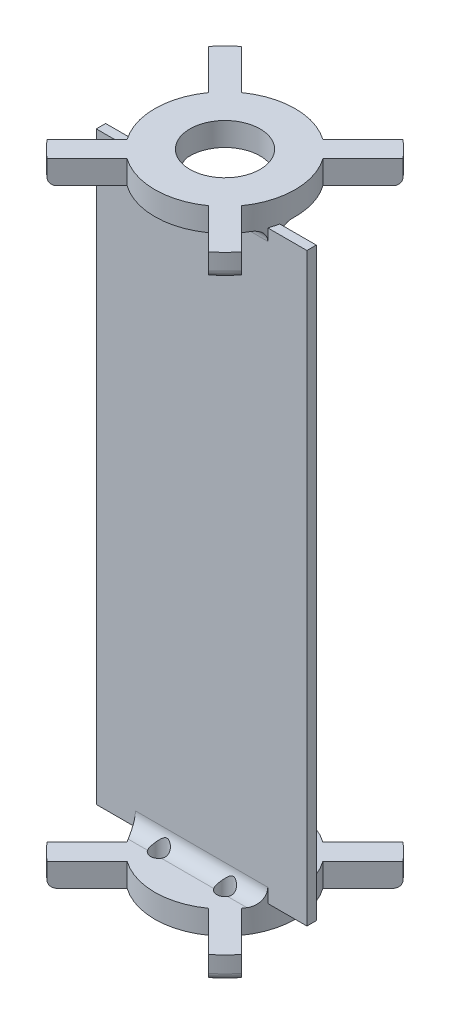
from build123d import *

# Parameters (mm, degrees)
SKETCH1_R           = 1.75
BOSS_EXTRUDE1_DEPTH = 5
SKETCH2_W           = 45
SKETCH2_H           = 2
BOSS_EXTRUDE2_DEPTH = 125
FILLET1_R           = 3
BOSS_EXTRUDE3_DEPTH = 5
FILLET2_R           = 2.5
FILLET3_R           = 1.5


with BuildPart() as part:
    # Sketch1 → Boss-Extrude1 (new body)
    with BuildSketch(Plane(origin=(0, 0, 0), x_dir=(1, 0, 0), z_dir=(0, 1, 0))):
        with BuildLine():
            Line((-17.242098907, 20.777632813), (-8.690483379, 12.226017285))
            ThreePointArc((-8.690483379, 12.226017285), (0, 15), (8.690483379, 12.226017285))
            Line((8.690483379, 12.226017285), (17.242098907, 20.777632813))
            ThreePointArc((17.242098907, 20.777632813), (19.091883092, 19.091883092), (20.777632813, 17.242098907))
            Line((20.777632813, 17.242098907), (12.226017285, 8.690483379))
            ThreePointArc((12.226017285, 8.690483379), (15, 0), (12.226017285, -8.690483379))
            Line((12.226017285, -8.690483379), (20.777632813, -17.242098907))
            ThreePointArc((20.777632813, -17.242098907), (19.091883092, -19.091883092), (17.242098907, -20.777632813))
            Line((17.242098907, -20.777632813), (8.690483379, -12.226017285))
            ThreePointArc((8.690483379, -12.226017285), (0, -15), (-8.690483379, -12.226017285))
            Line((-8.690483379, -12.226017285), (-17.242098907, -20.777632813))
            ThreePointArc((-17.242098907, -20.777632813), (-19.091883092, -19.091883092), (-20.777632813, -17.242098907))
            Line((-20.777632813, -17.242098907), (-12.226017285, -8.690483379))
            ThreePointArc((-12.226017285, -8.690483379), (-15, 0), (-12.226017285, 8.690483379))
            Line((-12.226017285, 8.690483379), (-20.777632813, 17.242098907))
            ThreePointArc((-20.777632813, 17.242098907), (-19.091883092, 19.091883092), (-17.242098907, 20.777632813))
        make_face()
        with Locations(Location((-7.071067812, 7.071067812, 0), (0, 0, 270))):
            Circle(SKETCH1_R, mode=Mode.SUBTRACT)
        with Locations(Location((7.071067812, 7.071067812, 0), (0, 0, 270))):
            Circle(SKETCH1_R, mode=Mode.SUBTRACT)
        with Locations(Location((7.071067812, -7.071067812, 0), (0, 0, 270))):
            Circle(SKETCH1_R, mode=Mode.SUBTRACT)
        with Locations(Location((-7.071067812, -7.071067812, 0), (0, 0, 270))):
            Circle(SKETCH1_R, mode=Mode.SUBTRACT)
    extrude(amount=BOSS_EXTRUDE1_DEPTH)

    # Sketch2 → Boss-Extrude2 (add)
    with BuildSketch(Plane(origin=(0, 5, 0), x_dir=(1, 0, 0), z_dir=(0, 1, 0))):
        with Locations((0, -4)):
            Rectangle(SKETCH2_W, SKETCH2_H)
    extrude(amount=BOSS_EXTRUDE2_DEPTH)

    # Fillet1
    # the kernel refuses this fillet: 3 mm, written as the material it adds along each edge
    with BuildSketch(Plane(origin=(-22.196938457, 5, 3), x_dir=(0, 0, -1), z_dir=(1, 0, 0))) as fillet1_piece_1_section:
        with BuildLine():
            CenterArc((FILLET1_R, FILLET1_R), FILLET1_R, 180, 90)
            Line((0, FILLET1_R), (0, 0))
            Line((0, 0), (FILLET1_R, 0))
        make_face()
    fillet1_piece_1 = extrude(amount=44.393876913, mode=Mode.PRIVATE)
    fillet1_piece_1 = fillet1_piece_1 & Plane(origin=(0, 5.668270053, 0), x_dir=(-0.8150678189761605, 0, 0.5793655585806295), z_dir=(0, -1, 0)) * Cylinder(15, 101, mode=Mode.PRIVATE)
    add(fillet1_piece_1)
    with BuildSketch(Plane(origin=(21.642135624, 5, 5), x_dir=(0, 0, 1), z_dir=(-1, 0, 0))) as fillet1_piece_2_section:
        with BuildLine():
            CenterArc((FILLET1_R, FILLET1_R), FILLET1_R, 180, 90)
            Line((0, FILLET1_R), (0, 0))
            Line((0, 0), (FILLET1_R, 0))
        make_face()
    fillet1_piece_2 = extrude(amount=43.284271247, mode=Mode.PRIVATE)
    fillet1_piece_2 = fillet1_piece_2 & Plane(origin=(0, 5.712393615, 0), x_dir=(-0.8150678189761605, 0, 0.5793655585806295), z_dir=(0, -1, 0)) * Cylinder(15, 99, mode=Mode.PRIVATE)
    fillet1_piece_2 = fillet1_piece_2 - Plane(origin=(7.071067812, 5.712393615, 7.071067812), x_dir=(0, 0, 1), z_dir=(0, -1, 0)) * Cylinder(1.75, 99, mode=Mode.PRIVATE)
    fillet1_piece_2 = fillet1_piece_2 - Plane(origin=(-7.071067812, 5.712393615, 7.071067812), x_dir=(0, 0, 1), z_dir=(0, -1, 0)) * Cylinder(1.75, 99, mode=Mode.PRIVATE)
    add(fillet1_piece_2)

    # Sketch3 → Boss-Extrude3 (add)
    with BuildSketch(Plane(origin=(0, 130, 0), x_dir=(1, 0, 0), z_dir=(0, 1, 0))):
        with BuildLine():
            Line((-8.690483379, 12.226017285), (-17.242098907, 20.777632813))
            ThreePointArc((-17.242098907, 20.777632813), (-19.091883092, 19.091883092), (-20.777632813, 17.242098907))
            Line((-20.777632813, 17.242098907), (-12.226017285, 8.690483379))
            ThreePointArc((-12.226017285, 8.690483379), (-14.675770401, 3.101896699), (-14.696938457, -3))
            Line((-14.696938457, -3), (-6.873863542, -3))
            ThreePointArc((-6.873863542, -3), (-1.532322328, 7.341797347), (7.5, 0))
            ThreePointArc((7.5, 0), (7.341797347, -1.532322328), (6.873863542, -3))
            Line((6.873863542, -3), (14.696938457, -3))
            ThreePointArc((14.696938457, -3), (14.675770401, 3.101896699), (12.226017285, 8.690483379))
            Line((12.226017285, 8.690483379), (20.777632813, 17.242098907))
            ThreePointArc((20.777632813, 17.242098907), (19.091883092, 19.091883092), (17.242098907, 20.777632813))
            Line((17.242098907, 20.777632813), (8.690483379, 12.226017285))
            ThreePointArc((8.690483379, 12.226017285), (0, 15), (-8.690483379, 12.226017285))
        make_face()
        with BuildLine():
            Line((-5.590169944, -5), (-14.142135624, -5))
            ThreePointArc((-14.142135624, -5), (-13.312580097, -6.911961455), (-12.226017285, -8.690483379))
            Line((-12.226017285, -8.690483379), (-20.777632813, -17.242098907))
            ThreePointArc((-20.777632813, -17.242098907), (-19.091883092, -19.091883092), (-17.242098907, -20.777632813))
            Line((-17.242098907, -20.777632813), (-8.690483379, -12.226017285))
            ThreePointArc((-8.690483379, -12.226017285), (0, -15), (8.690483379, -12.226017285))
            Line((8.690483379, -12.226017285), (17.242098907, -20.777632813))
            ThreePointArc((17.242098907, -20.777632813), (19.091883092, -19.091883092), (20.777632813, -17.242098907))
            Line((20.777632813, -17.242098907), (12.226017285, -8.690483379))
            ThreePointArc((12.226017285, -8.690483379), (13.312580097, -6.911961455), (14.142135624, -5))
            Line((14.142135624, -5), (5.590169944, -5))
            ThreePointArc((5.590169944, -5), (0, -7.5), (-5.590169944, -5))
        make_face()
        with BuildLine():
            Line((-6.873863542, -3), (-14.696938457, -3))
            ThreePointArc((-14.696938457, -3), (-14.454170625, -4.009607405), (-14.142135624, -5))
            Line((-14.142135624, -5), (-5.590169944, -5))
            ThreePointArc((-5.590169944, -5), (-6.311737691, -4.051168636), (-6.873863542, -3))
        make_face()
        with BuildLine():
            Line((14.696938457, -3), (6.873863542, -3))
            ThreePointArc((6.873863542, -3), (6.311737691, -4.051168636), (5.590169944, -5))
            Line((5.590169944, -5), (14.142135624, -5))
            ThreePointArc((14.142135624, -5), (14.454170625, -4.009607405), (14.696938457, -3))
        make_face()
    extrude(amount=BOSS_EXTRUDE3_DEPTH)

    # Fillet2
    # the kernel refuses this fillet: 2.5 mm, written as the material it adds along each edge
    with BuildSketch(Plane(origin=(0.623863542, 130, 3), x_dir=(0, -1, 0), z_dir=(1, 0, 0))) as fillet2_piece_1_section:
        with BuildLine():
            CenterArc((FILLET2_R, FILLET2_R), FILLET2_R, 180, 90)
            Line((0, FILLET2_R), (0, 0))
            Line((0, 0), (FILLET2_R, 0))
        make_face()
    fillet2_piece_1 = extrude(amount=20.323074914, mode=Mode.PRIVATE)
    fillet2_piece_1 = fillet2_piece_1 & Plane(origin=(0, 129.438759942, 0), x_dir=(0.9797958971132683, 0, 0.20000000000001464), z_dir=(0, -1, 0)) * Cylinder(15, 51, mode=Mode.PRIVATE)
    fillet2_piece_1 = fillet2_piece_1 - Plane(origin=(0, 129.438759942, 0), x_dir=(-0.9165151389911752, 0, 0.3999999999999837), z_dir=(0, -1, 0)) * Cylinder(7.5, 51, mode=Mode.PRIVATE)
    add(fillet2_piece_1)
    with BuildSketch(Plane(origin=(-20.946938457, 130, 3), x_dir=(0, -1, 0), z_dir=(1, 0, 0))) as fillet2_piece_2_section:
        with BuildLine():
            CenterArc((FILLET2_R, FILLET2_R), FILLET2_R, 180, 90)
            Line((0, FILLET2_R), (0, 0))
            Line((0, 0), (FILLET2_R, 0))
        make_face()
    fillet2_piece_2 = extrude(amount=20.323074914, mode=Mode.PRIVATE)
    fillet2_piece_2 = fillet2_piece_2 & Plane(origin=(0, 129.438753498, 0), x_dir=(-0.8150678189761544, 0, -0.5793655585806381), z_dir=(0, -1, 0)) * Cylinder(15, 51, mode=Mode.PRIVATE)
    fillet2_piece_2 = fillet2_piece_2 - Plane(origin=(0, 129.438753498, 0), x_dir=(-0.9165151389911752, 0, 0.3999999999999837), z_dir=(0, -1, 0)) * Cylinder(7.5, 51, mode=Mode.PRIVATE)
    add(fillet2_piece_2)
    with BuildSketch(Plane(origin=(0.659830056, 130, 5), x_dir=(0, -1, 0), z_dir=(-1, 0, 0))) as fillet2_piece_3_section:
        with BuildLine():
            CenterArc((FILLET2_R, FILLET2_R), FILLET2_R, 180, 90)
            Line((0, FILLET2_R), (0, 0))
            Line((0, 0), (FILLET2_R, 0))
        make_face()
    fillet2_piece_3 = extrude(amount=21.05196568, mode=Mode.PRIVATE)
    fillet2_piece_3 = fillet2_piece_3 & Plane(origin=(0, 129.999967714, 0), x_dir=(-0.8150678189761544, 0, -0.5793655585806381), z_dir=(0, -1, 0)) * Cylinder(15, 53, mode=Mode.PRIVATE)
    fillet2_piece_3 = fillet2_piece_3 - Plane(origin=(0, 129.999967714, 0), x_dir=(-0.9165151389911752, 0, 0.3999999999999837), z_dir=(0, -1, 0)) * Cylinder(7.5, 53, mode=Mode.PRIVATE)
    add(fillet2_piece_3)
    with BuildSketch(Plane(origin=(20.392135624, 130, 5), x_dir=(0, -1, 0), z_dir=(-1, 0, 0))) as fillet2_piece_4_section:
        with BuildLine():
            CenterArc((FILLET2_R, FILLET2_R), FILLET2_R, 180, 90)
            Line((0, FILLET2_R), (0, 0))
            Line((0, 0), (FILLET2_R, 0))
        make_face()
    fillet2_piece_4 = extrude(amount=21.05196568, mode=Mode.PRIVATE)
    fillet2_piece_4 = fillet2_piece_4 & Plane(origin=(0, 129.453164876, 0), x_dir=(0.9797958971132683, 0, 0.20000000000001464), z_dir=(0, -1, 0)) * Cylinder(15, 53, mode=Mode.PRIVATE)
    fillet2_piece_4 = fillet2_piece_4 - Plane(origin=(0, 129.453164876, 0), x_dir=(-0.9165151389911752, 0, 0.3999999999999837), z_dir=(0, -1, 0)) * Cylinder(7.5, 53, mode=Mode.PRIVATE)
    add(fillet2_piece_4)

    # Fillet3
    fillet3_edges = [part.edges().sort_by_distance(p)[0] for p in [
        (19.091883092, 130, -19.091883092),
        (-19.091883092, 130, -19.091883092),
        (-19.091883092, 130, 19.091883092),
        (19.091883092, 130, 19.091883092),
        (19.091883092, 0, -19.091883092),
        (19.091883092, 0, 19.091883092),
        (-19.091883092, 0, 19.091883092),
        (-19.091883092, 0, -19.091883092),
    ]]
    fillet(fillet3_edges, radius=FILLET3_R)


solid = part.part
